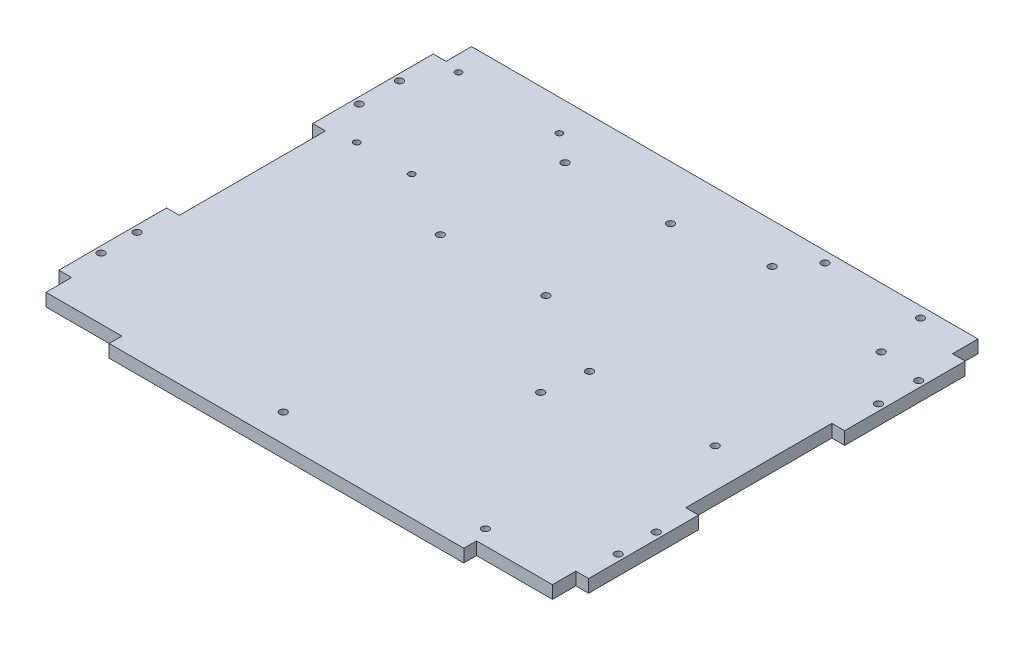
from build123d import *

# Parameters (mm, degrees)
SKETCH1_W                  = 500
SKETCH1_H                  = 411.98
BOSS_EXTRUDE1_DEPTH        = 12
SKETCH2_W                  = 83.333333333
SKETCH2_H                  = 12
SKETCH2_W_2                = 12
SKETCH2_H_2                = 137.326666666
CUT_EXTRUDE1_DEPTH         = 12
SKETCH4_W                  = 12
SKETCH4_H                  = 24
SKETCH4_H_2                = 22
CUT_EXTRUDE2_DEPTH         = 12
SCALE1_SCALE               = 0.5
M2_5_START                 = 3
M2_5_CLEARANCE_SLOT1_DEPTH = 6
M3_CLEARANCE_SLOT1_D       = 3.4
M3_CLEARANCE_SLOT2_D       = 3.4


# Read off the part's stored shape, not the designer's step: M2.5 Clearance Slot1
with BuildPart() as part:
    # Sketch1 → Boss-Extrude1 (new body)
    with BuildSketch(Plane(origin=(0, 0, 0), x_dir=(1, 0, 0), z_dir=(0, 1, 0))):
        with Locations((250, 205.99)):
            Rectangle(SKETCH1_W, SKETCH1_H)
    extrude(amount=BOSS_EXTRUDE1_DEPTH)

    # Sketch2 → Cut-Extrude1 (cut)
    with BuildSketch(Plane(origin=(0, 12, 0), x_dir=(1, 0, 0), z_dir=(0, 1, 0))):
        with Locations((41.666666666, 6)):
            Rectangle(SKETCH2_W, SKETCH2_H)
        with Locations((458.333333334, 6)):
            Rectangle(SKETCH2_W, SKETCH2_H)
        with Locations((6, 205.99)):
            Rectangle(SKETCH2_W_2, SKETCH2_H_2)
        with Locations((494, 205.99)):
            Rectangle(SKETCH2_W_2, SKETCH2_H_2)
    extrude(amount=-CUT_EXTRUDE1_DEPTH, mode=Mode.SUBTRACT)

    # Sketch4 → Cut-Extrude2 (cut)
    with BuildSketch(Plane(origin=(0, 12, 0), x_dir=(1, 0, 0), z_dir=(0, 1, 0))):
        with Locations((6, 399.98)):
            Rectangle(SKETCH4_W, SKETCH4_H)
        with Locations((494, 399.98)):
            Rectangle(SKETCH4_W, SKETCH4_H)
        with Locations((494, 23)):
            Rectangle(SKETCH4_W, SKETCH4_H_2)
        with Locations((6, 24)):
            Rectangle(SKETCH4_W, SKETCH4_H)
    extrude(amount=-CUT_EXTRUDE2_DEPTH, mode=Mode.SUBTRACT)


with BuildPart() as part_1:
    # Scale1: scaled about (250.029343652, 6, -207.939049077)
    add(part.part.scale(SCALE1_SCALE).moved(Location((125.014671826, 3, -103.969524538))))

    # M2.5 Clearance Slot1 outline → M2.5 Clearance Slot1 (cut)
    with BuildSketch(Plane(origin=(0, 0, 0), x_dir=(1, 0, 0), z_dir=(0, 1, 0)).offset(M2_5_START)):
        with BuildLine():
            Line((138.354717143, 294.959902024), (138.454714786, 294.959215412))
            ThreePointArc((138.454714786, 294.959215412), (139.914636468, 296.399225372), (138.474626509, 297.859147054))
            Line((138.474626509, 297.859147054), (138.374628867, 297.859833665))
            ThreePointArc((138.374628867, 297.859833665), (136.914707184, 296.419823707), (138.354717143, 294.959902024))
        make_face()
        with BuildLine():
            Line((186.854717143, 293.859902024), (186.954714786, 293.859215412))
            ThreePointArc((186.954714786, 293.859215412), (188.414636468, 295.299225372), (186.974626509, 296.759147054))
            Line((186.974626509, 296.759147054), (186.874628867, 296.759833665))
            ThreePointArc((186.874628867, 296.759833665), (185.414707184, 295.319823707), (186.854717143, 293.859902024))
        make_face()
        with BuildLine():
            Line((168.754717143, 242.559902024), (168.854714786, 242.559215412))
            ThreePointArc((168.854714786, 242.559215412), (170.314636468, 243.999225372), (168.874626509, 245.459147054))
            Line((168.874626509, 245.459147054), (168.774628867, 245.459833665))
            ThreePointArc((168.774628867, 245.459833665), (167.314707184, 244.019823707), (168.754717143, 242.559902024))
        make_face()
        with BuildLine():
            Line((142.954717143, 242.559902024), (143.054714786, 242.559215412))
            ThreePointArc((143.054714786, 242.559215412), (144.514636468, 243.999225372), (143.074626509, 245.459147054))
            Line((143.074626509, 245.459147054), (142.974628867, 245.459833665))
            ThreePointArc((142.974628867, 245.459833665), (141.514707184, 244.019823707), (142.954717143, 242.559902024))
        make_face()
    extrude(amount=M2_5_CLEARANCE_SLOT1_DEPTH, mode=Mode.SUBTRACT)

    # M3 Clearance Slot1 (through all)
    with Locations(Plane(origin=(0, 9, 0), x_dir=(1, 0, 0), z_dir=(0, 1, 0))):
        with Locations((200.214671826, 226.059524539), (200.214671826, 284.659524539), (249.814671826, 284.659524539), (249.814671826, 226.059524539), (235.514671826, 116.964788111), (288.014671826, 185.464788111), (330.514671826, 116.964788111), (290.914671826, 205.488524539), (291.144671826, 291.089524539), (351.524671826, 281.939524539), (350.704671826, 204.749524539), (302.114671826, 304.959524539), (347.014671826, 304.959524539)):
            Hole(M3_CLEARANCE_SLOT1_D / 2)

    # M3 Clearance Slot2 (through all)
    with Locations(Plane(origin=(0, 3, 0), x_dir=(-1, 0, 0), z_dir=(0, -1, 0))):
        with Locations((-372.014671826, 137.856191205), (-372.014671826, 155.746191205), (-372.014671826, 260.182857872), (-372.014671826, 279.072857872), (-128.014671826, 138.856191205), (-128.014671826, 155.746191205), (-128.014671826, 260.182857872), (-128.014671826, 279.072857872)):
            Hole(M3_CLEARANCE_SLOT2_D / 2)


solid = part_1.part
